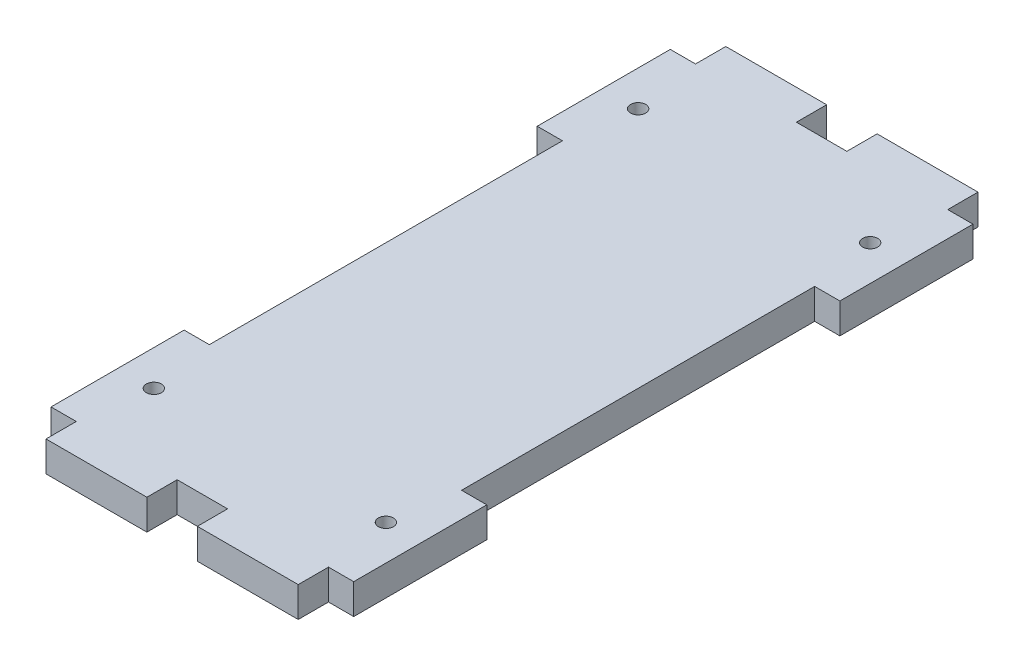
from build123d import *

# Parameters (mm, degrees)
ESQUISSE1_W             = 60
ESQUISSE1_H             = 122.76
BOSS_EXTRU_1_DEPTH      = 6
ESQUISSE2_W             = 20
ESQUISSE2_H             = 6
BOSS_EXTRU_2_DEPTH      = 6
ESQUISSE3_R             = 1.5
ENL_V_MAT_EXTRU_1_DEPTH = 6
ESQUISSE4_W             = 5
ESQUISSE4_H             = 70
ENL_V_MAT_EXTRU_2_DEPTH = 6


with BuildPart() as part:
    # Esquisse1 → Boss.-Extru.1 (new body)
    with BuildSketch(Plane(origin=(0, 0, 0), x_dir=(1, 0, 0), z_dir=(0, 1, 0))):
        Rectangle(ESQUISSE1_W, ESQUISSE1_H)
    extrude(amount=BOSS_EXTRU_1_DEPTH)

    # Esquisse2 → Boss.-Extru.2 (add)
    with BuildSketch(Plane(origin=(0, 6, 0), x_dir=(1, 0, 0), z_dir=(0, 1, 0))):
        with Locations((-15, 64.38)):
            Rectangle(ESQUISSE2_W, ESQUISSE2_H)
        with Locations((15, 64.38)):
            Rectangle(ESQUISSE2_W, ESQUISSE2_H)
        with Locations((15, -64.38)):
            Rectangle(ESQUISSE2_W, ESQUISSE2_H)
        with Locations((-15, -64.38)):
            Rectangle(ESQUISSE2_W, ESQUISSE2_H)
    extrude(amount=-BOSS_EXTRU_2_DEPTH)

    # Esquisse3 → Enlèv. mat.-Extru.1 (cut)
    with BuildSketch(Plane(origin=(0, 6, 0), x_dir=(1, 0, 0), z_dir=(0, 1, 0))):
        with Locations((23, 48)):
            Circle(ESQUISSE3_R)
        with Locations((-23, 48)):
            Circle(ESQUISSE3_R)
        with Locations((-23, -48)):
            Circle(ESQUISSE3_R)
        with Locations((23, -48)):
            Circle(ESQUISSE3_R)
    extrude(amount=-ENL_V_MAT_EXTRU_1_DEPTH, mode=Mode.SUBTRACT)

    # Esquisse4 → Enlèv. mat.-Extru.2 (cut)
    with BuildSketch(Plane(origin=(0, 6, 0), x_dir=(1, 0, 0), z_dir=(0, 1, 0))):
        with Locations((-27.5, 0)):
            Rectangle(ESQUISSE4_W, ESQUISSE4_H)
        with Locations((27.5, 0)):
            Rectangle(ESQUISSE4_W, ESQUISSE4_H)
    extrude(amount=-ENL_V_MAT_EXTRU_2_DEPTH, mode=Mode.SUBTRACT)


solid = part.part
